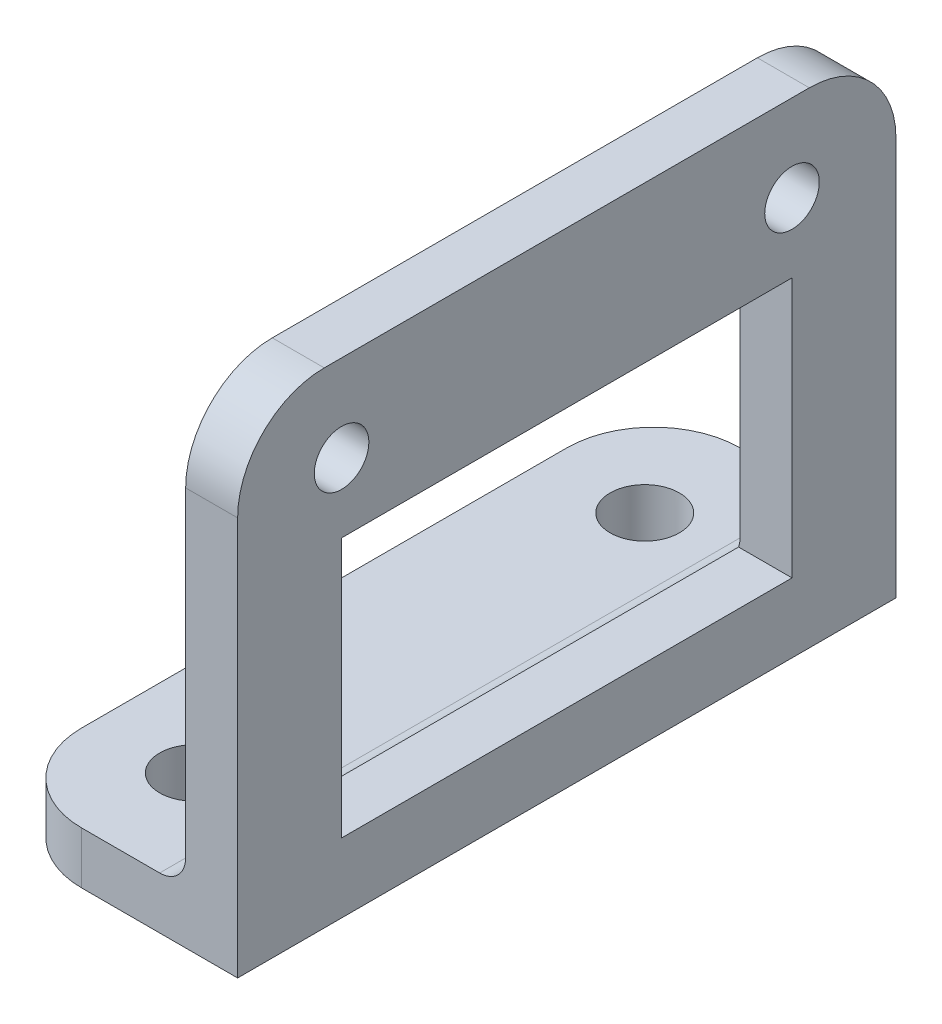
from build123d import *

# Parameters (mm, degrees)
BOSS_EXTRUDE1_DEPTH     = 19
CUT_EXTRUDE1_DEPTH      = 33.954514107
CUT_EXTRUDE1_DEPTH_BACK = 33.954514107
SKETCH2_R               = 2
SKETCH3_R               = 1.575
SKETCH3_W               = 26
SKETCH3_H               = 15
CUT_EXTRUDE2_DEPTH      = 36.580893749
FILLET1_R               = 1.5
FILLET2_R               = 5


with BuildPart() as part:
    # Sketch1 → Boss-Extrude1 (new, symmetric)
    with BuildSketch(Plane.XY):
        Polygon((0, 0), (4, 0), (4, 28), (1, 28), (1, 3), (-10, 3), (-10, 0), align=None)
    extrude(amount=BOSS_EXTRUDE1_DEPTH, both=True)

    # Sketch2 → Cut-Extrude1 (cut, two sides: drawn at the far end of the back side and taken through both)
    with BuildSketch(Plane(origin=(0, 3, 0), x_dir=(1, 0, 0), z_dir=(0, 1, 0)).offset(-CUT_EXTRUDE1_DEPTH_BACK)):
        with Locations(Location((-4.5, 13, 0), (0, 0, 180))):
            Circle(SKETCH2_R)
        with Locations((-4.5, -13)):
            Circle(SKETCH2_R)
    extrude(amount=CUT_EXTRUDE1_DEPTH + CUT_EXTRUDE1_DEPTH_BACK, mode=Mode.SUBTRACT)

    # Sketch3 → Cut-Extrude2 (cut, through all)
    with BuildSketch(Plane.ZY.offset(-1)):
        with Locations((-13, 23)):
            Circle(SKETCH3_R)
        with Locations(Location((13, 23, 0), (0, 0, 180))):
            Circle(SKETCH3_R)
        with Locations((0, 11.5)):
            Rectangle(SKETCH3_W, SKETCH3_H)
    extrude(amount=-CUT_EXTRUDE2_DEPTH, mode=Mode.SUBTRACT)

    # Fillet1
    # the kernel refuses this fillet: 1.5 mm, written as the material it adds along each edge
    with BuildSketch(Plane(origin=(1, 3, -19), x_dir=(0, 1, 0), z_dir=(0, 0, 1))) as fillet1_piece_1_section:
        with BuildLine():
            CenterArc((FILLET1_R, FILLET1_R), FILLET1_R, 180, 90)
            Line((0, FILLET1_R), (0, 0))
            Line((0, 0), (FILLET1_R, 0))
        make_face()
    fillet1_piece_1 = extrude(amount=38, mode=Mode.PRIVATE)
    fillet1_piece_1 = split(fillet1_piece_1, bisect_by=Plane(origin=(0.995303959, 4, -16), z_dir=(0, 1, 0)), keep=Keep.TOP, mode=Mode.PRIVATE)
    fillet1_piece_1 = split(fillet1_piece_1, bisect_by=Plane(origin=(0.995303959, 4.189014255, -13), z_dir=(0, 0, -1)), keep=Keep.TOP, mode=Mode.PRIVATE)
    add(fillet1_piece_1)
    with BuildSketch(Plane(origin=(1, 3, -19), x_dir=(0, 1, 0), z_dir=(0, 0, 1))) as fillet1_piece_2_section:
        with BuildLine():
            CenterArc((FILLET1_R, FILLET1_R), FILLET1_R, 180, 90)
            Line((0, FILLET1_R), (0, 0))
            Line((0, 0), (FILLET1_R, 0))
        make_face()
    fillet1_piece_2 = extrude(amount=38, mode=Mode.PRIVATE)
    fillet1_piece_2 = split(fillet1_piece_2, bisect_by=Plane(origin=(0.642494848, 4, -16), z_dir=(0, -1, 0)), keep=Keep.TOP, mode=Mode.PRIVATE)
    fillet1_piece_2 = split(fillet1_piece_2, bisect_by=Plane(origin=(0.642494848, 3.294160002, -13), z_dir=(0, 0, -1)), keep=Keep.TOP, mode=Mode.PRIVATE)
    add(fillet1_piece_2)
    with BuildSketch(Plane(origin=(1, 3, -19), x_dir=(0, 1, 0), z_dir=(0, 0, 1))) as fillet1_piece_3_section:
        with BuildLine():
            CenterArc((FILLET1_R, FILLET1_R), FILLET1_R, 180, 90)
            Line((0, FILLET1_R), (0, 0))
            Line((0, 0), (FILLET1_R, 0))
        make_face()
    fillet1_piece_3 = extrude(amount=38, mode=Mode.PRIVATE)
    fillet1_piece_3 = split(fillet1_piece_3, bisect_by=Plane(origin=(0.642494848, 4, 0), z_dir=(0, -1, 0)), keep=Keep.TOP, mode=Mode.PRIVATE)
    fillet1_piece_3 = split(fillet1_piece_3, bisect_by=Plane(origin=(0.642494848, 3.294160002, -13), z_dir=(0, 0, 1)), keep=Keep.TOP, mode=Mode.PRIVATE)
    fillet1_piece_3 = split(fillet1_piece_3, bisect_by=Plane(origin=(0.642494848, 3.294160002, 13), z_dir=(0, 0, -1)), keep=Keep.TOP, mode=Mode.PRIVATE)
    add(fillet1_piece_3)
    with BuildSketch(Plane(origin=(1, 3, -19), x_dir=(0, 1, 0), z_dir=(0, 0, 1))) as fillet1_piece_4_section:
        with BuildLine():
            CenterArc((FILLET1_R, FILLET1_R), FILLET1_R, 180, 90)
            Line((0, FILLET1_R), (0, 0))
            Line((0, 0), (FILLET1_R, 0))
        make_face()
    fillet1_piece_4 = extrude(amount=38, mode=Mode.PRIVATE)
    fillet1_piece_4 = split(fillet1_piece_4, bisect_by=Plane(origin=(0.995303959, 4, 16), z_dir=(0, 1, 0)), keep=Keep.TOP, mode=Mode.PRIVATE)
    fillet1_piece_4 = split(fillet1_piece_4, bisect_by=Plane(origin=(0.995303959, 4.189014255, 13), z_dir=(0, 0, 1)), keep=Keep.TOP, mode=Mode.PRIVATE)
    add(fillet1_piece_4)
    with BuildSketch(Plane(origin=(1, 3, -19), x_dir=(0, 1, 0), z_dir=(0, 0, 1))) as fillet1_piece_5_section:
        with BuildLine():
            CenterArc((FILLET1_R, FILLET1_R), FILLET1_R, 180, 90)
            Line((0, FILLET1_R), (0, 0))
            Line((0, 0), (FILLET1_R, 0))
        make_face()
    fillet1_piece_5 = extrude(amount=38, mode=Mode.PRIVATE)
    fillet1_piece_5 = split(fillet1_piece_5, bisect_by=Plane(origin=(0.642494848, 4, 16), z_dir=(0, -1, 0)), keep=Keep.TOP, mode=Mode.PRIVATE)
    fillet1_piece_5 = split(fillet1_piece_5, bisect_by=Plane(origin=(0.642494848, 3.294160002, 13), z_dir=(0, 0, 1)), keep=Keep.TOP, mode=Mode.PRIVATE)
    add(fillet1_piece_5)

    # Fillet2
    fillet2_edges = [part.edges().sort_by_distance(p)[0] for p in [
        (2.5, 28, 19),
        (-10, 1.5, 19),
        (-10, 1.5, -19),
        (2.5, 28, -19),
    ]]
    fillet(fillet2_edges, radius=FILLET2_R)


solid = part.part
